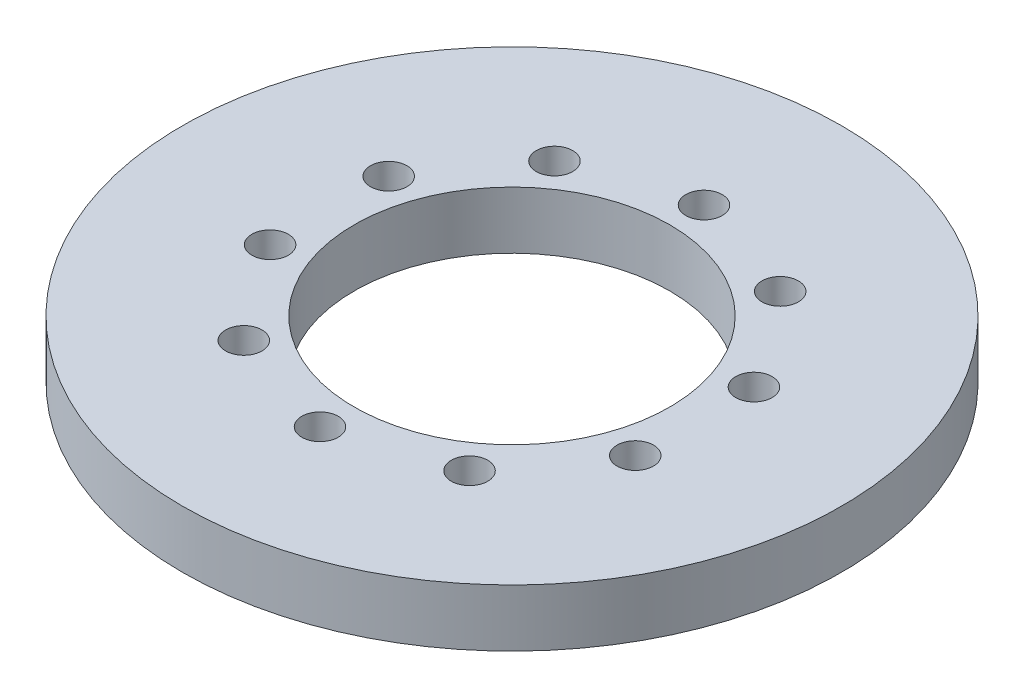
from build123d import *

# Parameters (mm, degrees)
SKETCH1_R            = 36.5125
SKETCH1_R_2          = 17.4879
BOSS_EXTRUDE1_DEPTH  = 9.525
SKETCH2_R            = 17.4879
SKETCH2_R_2          = 12.7
BOSS_EXTRUDE2_DEPTH  = 9.525
SKETCH3_R            = 2.0193
CUT_EXTRUDE1_DEPTH   = 56.038421239
SKETCH4_W            = 4.7625
SKETCH4_H            = 9.525
CUT_EXTRUDE2_START   = -12.7
SKETCH5_R            = 2.4892
CUT_EXTRUDE2_DEPTH   = 12.7
CIRPATTERN1_COUNT    = 10
SPLIT1_START         = -9.525
SPLIT1_OUTLINE_R     = 36.5125
SPLIT1_OUTLINE_R_2   = 2.4892
SPLIT1_OUTLINE_R_3   = 12.7
SPLIT1_DEPTH         = 12.7
SPLIT1_START_2       = -6.35
SPLIT1_2_OUTLINE_R   = 31.75
SPLIT1_2_OUTLINE_R_2 = 2.4892
SPLIT1_2_OUTLINE_R_3 = 12.7
SPLIT1_2_DEPTH       = 6.35
SPLIT1_3_OUTLINE_R   = 31.75
SPLIT1_3_OUTLINE_R_2 = 2.4892
SPLIT1_3_OUTLINE_R_3 = 17.4879
SPLIT1_3_DEPTH       = 3.175
SPLIT1_4_OUTLINE_R   = 36.5125
SPLIT1_4_OUTLINE_R_2 = 2.4892
SPLIT1_4_OUTLINE_R_3 = 12.7
SPLIT1_4_DEPTH       = 3.175


# Read off the part's stored shape, not the designer's step: Split1
with BuildPart() as part:
    # Sketch1 → Boss-Extrude1 (new, symmetric)
    with BuildSketch(Plane(origin=(0, 0, 0), x_dir=(1, 0, 0), z_dir=(0, 1, 0))):
        with Locations(Location((0, 0, 0), (0, 0, 90))):
            Circle(SKETCH1_R)
        with Locations(Location((0, 0, 0), (0, 0, 90))):
            Circle(SKETCH1_R_2, mode=Mode.SUBTRACT)
    extrude(amount=BOSS_EXTRUDE1_DEPTH, both=True)

    # Sketch2 → Boss-Extrude2 (add)
    with BuildSketch(Plane.XZ.offset(9.525)):
        with Locations(Location((0, 0, 0), (0, 0, 270))):
            Circle(SKETCH2_R)
        with Locations(Location((0, 0, 0), (0, 0, 270))):
            Circle(SKETCH2_R_2, mode=Mode.SUBTRACT)
    extrude(amount=-BOSS_EXTRUDE2_DEPTH)

    # Sketch3 → Cut-Extrude1 (cut, through all)
    with BuildSketch(Plane.XZ.offset(9.525)):
        with Locations(Location((0, 21.2725, 0), (0, 0, 270))):
            Circle(SKETCH3_R)
    cut_extrude1 = extrude(amount=-CUT_EXTRUDE1_DEPTH, mode=Mode.SUBTRACT)

    # Sketch4 → Cut-Revolve1 (revolve, cut)
    with BuildSketch(Plane(origin=(0, 0, 0), x_dir=(0, 0, -1), z_dir=(1, 0, 0)), mode=Mode.PRIVATE) as cut_revolve1_sk:
        with Locations((-34.13125, -1.5875)):
            Rectangle(SKETCH4_W, SKETCH4_H)
    revolve(cut_revolve1_sk.sketch.rotate(Axis((0, 0, 0), (0, 1, 0)), 180), axis=Axis((0, 0, 0), (0, 1, 0)), mode=Mode.SUBTRACT)

    # Sketch5 → Cut-Extrude2 (cut)
    with BuildSketch(Plane.XZ.offset(9.525).offset(CUT_EXTRUDE2_START)):
        with Locations(Location((0, 21.2725, 0), (0, 0, 270))):
            Circle(SKETCH5_R)
    cut_extrude2 = extrude(amount=CUT_EXTRUDE2_DEPTH, mode=Mode.SUBTRACT)

    # CirPattern1: Cut-Extrude1, Cut-Extrude2 ×10 about axis
    cirpattern1_axis = Axis((0, 0, 0), (0, 1, 0))
    add([cut_extrude1.rotate(cirpattern1_axis, i * 360 / CIRPATTERN1_COUNT) for i in range(1, CIRPATTERN1_COUNT)], mode=Mode.SUBTRACT)
    add([cut_extrude2.rotate(cirpattern1_axis, i * 360 / CIRPATTERN1_COUNT) for i in range(1, CIRPATTERN1_COUNT)], mode=Mode.SUBTRACT)

    # Split1 outline → Split1 (cut)
    with BuildSketch(Plane(origin=(0, 0, 0), x_dir=(1, 0, 0), z_dir=(0, 1, 0)).offset(SPLIT1_START)):
        Circle(SPLIT1_OUTLINE_R)
        with Locations((0, 21.2725)):
            Circle(SPLIT1_OUTLINE_R_2, mode=Mode.SUBTRACT)
        with Locations((-20.231349743, -6.573564013)):
            Circle(SPLIT1_OUTLINE_R_2, mode=Mode.SUBTRACT)
        with Locations((-12.503661779, -17.209814013)):
            Circle(SPLIT1_OUTLINE_R_2, mode=Mode.SUBTRACT)
        with Locations((0, -21.2725)):
            Circle(SPLIT1_OUTLINE_R_2, mode=Mode.SUBTRACT)
        with Locations((12.503661779, -17.209814013)):
            Circle(SPLIT1_OUTLINE_R_2, mode=Mode.SUBTRACT)
        with Locations((20.231349743, -6.573564013)):
            Circle(SPLIT1_OUTLINE_R_2, mode=Mode.SUBTRACT)
        with Locations((-20.231349743, 6.573564013)):
            Circle(SPLIT1_OUTLINE_R_2, mode=Mode.SUBTRACT)
        with Locations((-12.503661779, 17.209814013)):
            Circle(SPLIT1_OUTLINE_R_2, mode=Mode.SUBTRACT)
        with Locations((12.503661779, 17.209814013)):
            Circle(SPLIT1_OUTLINE_R_2, mode=Mode.SUBTRACT)
        with Locations((20.231349743, 6.573564013)):
            Circle(SPLIT1_OUTLINE_R_2, mode=Mode.SUBTRACT)
        Circle(SPLIT1_OUTLINE_R_3, mode=Mode.SUBTRACT)
    extrude(amount=SPLIT1_DEPTH, mode=Mode.SUBTRACT)


with BuildPart() as body_2:
    # Split1 2 outline → Split1 2 (new body)
    with BuildSketch(Plane(origin=(0, 0, 0), x_dir=(1, 0, 0), z_dir=(0, 1, 0)).offset(SPLIT1_START_2)):
        Circle(SPLIT1_2_OUTLINE_R)
        with Locations((-12.503661779, -17.209814013)):
            Circle(SPLIT1_2_OUTLINE_R_2, mode=Mode.SUBTRACT)
        with Locations((-20.231349743, -6.573564013)):
            Circle(SPLIT1_2_OUTLINE_R_2, mode=Mode.SUBTRACT)
        with Locations((0, -21.2725)):
            Circle(SPLIT1_2_OUTLINE_R_2, mode=Mode.SUBTRACT)
        with Locations((12.503661779, -17.209814013)):
            Circle(SPLIT1_2_OUTLINE_R_2, mode=Mode.SUBTRACT)
        with Locations((20.231349743, -6.573564013)):
            Circle(SPLIT1_2_OUTLINE_R_2, mode=Mode.SUBTRACT)
        with Locations((-20.231349743, 6.573564013)):
            Circle(SPLIT1_2_OUTLINE_R_2, mode=Mode.SUBTRACT)
        with Locations((-12.503661779, 17.209814013)):
            Circle(SPLIT1_2_OUTLINE_R_2, mode=Mode.SUBTRACT)
        Circle(SPLIT1_2_OUTLINE_R_3, mode=Mode.SUBTRACT)
        with Locations((20.231349743, 6.573564013)):
            Circle(SPLIT1_2_OUTLINE_R_2, mode=Mode.SUBTRACT)
        with Locations((0, 21.2725)):
            Circle(SPLIT1_2_OUTLINE_R_2, mode=Mode.SUBTRACT)
        with Locations((12.503661779, 17.209814013)):
            Circle(SPLIT1_2_OUTLINE_R_2, mode=Mode.SUBTRACT)
    extrude(amount=SPLIT1_2_DEPTH)


with BuildPart() as body_3:
    # Split1 3 outline → Split1 3 (new body)
    with BuildSketch(Plane(origin=(0, 0, 0), x_dir=(1, 0, 0), z_dir=(0, 1, 0))):
        Circle(SPLIT1_3_OUTLINE_R)
        with Locations((-12.503661779, -17.209814013)):
            Circle(SPLIT1_3_OUTLINE_R_2, mode=Mode.SUBTRACT)
        with Locations((-20.231349743, -6.573564013)):
            Circle(SPLIT1_3_OUTLINE_R_2, mode=Mode.SUBTRACT)
        with Locations((0, -21.2725)):
            Circle(SPLIT1_3_OUTLINE_R_2, mode=Mode.SUBTRACT)
        with Locations((12.503661779, -17.209814013)):
            Circle(SPLIT1_3_OUTLINE_R_2, mode=Mode.SUBTRACT)
        with Locations((20.231349743, -6.573564013)):
            Circle(SPLIT1_3_OUTLINE_R_2, mode=Mode.SUBTRACT)
        with Locations((-20.231349743, 6.573564013)):
            Circle(SPLIT1_3_OUTLINE_R_2, mode=Mode.SUBTRACT)
        with Locations((-12.503661779, 17.209814013)):
            Circle(SPLIT1_3_OUTLINE_R_2, mode=Mode.SUBTRACT)
        Circle(SPLIT1_3_OUTLINE_R_3, mode=Mode.SUBTRACT)
        with Locations((20.231349743, 6.573564013)):
            Circle(SPLIT1_3_OUTLINE_R_2, mode=Mode.SUBTRACT)
        with Locations((0, 21.2725)):
            Circle(SPLIT1_3_OUTLINE_R_2, mode=Mode.SUBTRACT)
        with Locations((12.503661779, 17.209814013)):
            Circle(SPLIT1_3_OUTLINE_R_2, mode=Mode.SUBTRACT)
    extrude(amount=SPLIT1_3_DEPTH)


with BuildPart() as body_4:
    # Split1 4 outline → Split1 4 (new body)
    with BuildSketch(Plane(origin=(0, 0, 0), x_dir=(1, 0, 0), z_dir=(0, 1, 0)).offset(SPLIT1_START)):
        Circle(SPLIT1_4_OUTLINE_R)
        with Locations((-20.231349743, -6.573564013)):
            Circle(SPLIT1_4_OUTLINE_R_2, mode=Mode.SUBTRACT)
        with Locations((-12.503661779, -17.209814013)):
            Circle(SPLIT1_4_OUTLINE_R_2, mode=Mode.SUBTRACT)
        with Locations((0, -21.2725)):
            Circle(SPLIT1_4_OUTLINE_R_2, mode=Mode.SUBTRACT)
        with Locations((12.503661779, -17.209814013)):
            Circle(SPLIT1_4_OUTLINE_R_2, mode=Mode.SUBTRACT)
        with Locations((20.231349743, -6.573564013)):
            Circle(SPLIT1_4_OUTLINE_R_2, mode=Mode.SUBTRACT)
        with Locations((-20.231349743, 6.573564013)):
            Circle(SPLIT1_4_OUTLINE_R_2, mode=Mode.SUBTRACT)
        with Locations((-12.503661779, 17.209814013)):
            Circle(SPLIT1_4_OUTLINE_R_2, mode=Mode.SUBTRACT)
        Circle(SPLIT1_4_OUTLINE_R_3, mode=Mode.SUBTRACT)
        with Locations((12.503661779, 17.209814013)):
            Circle(SPLIT1_4_OUTLINE_R_2, mode=Mode.SUBTRACT)
        with Locations((20.231349743, 6.573564013)):
            Circle(SPLIT1_4_OUTLINE_R_2, mode=Mode.SUBTRACT)
        with Locations((0, 21.2725)):
            Circle(SPLIT1_4_OUTLINE_R_2, mode=Mode.SUBTRACT)
    extrude(amount=SPLIT1_4_DEPTH)


solid = part.part
